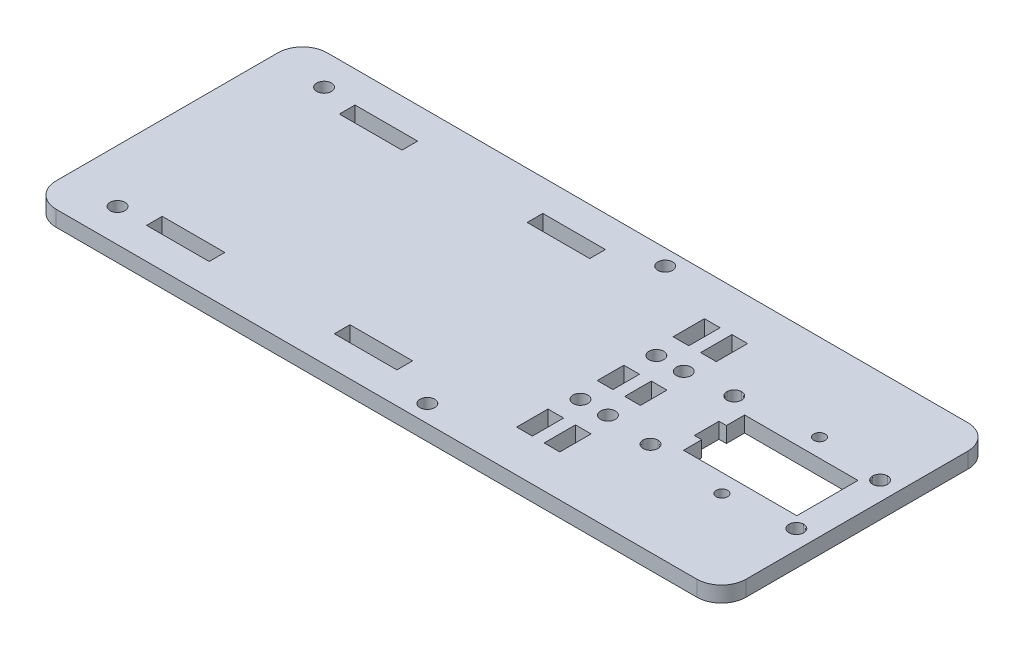
from build123d import *

# Parameters (mm, degrees)
SKETCH1_R           = 1.5
SKETCH1_R_2         = 1.15
SKETCH1_W           = 3.175
SKETCH1_H           = 6.35
SKETCH1_H_2         = 5.4
SKETCH1_W_2         = 12.7
SKETCH1_H_3         = 3.175
BOSS_EXTRUDE1_DEPTH = 3.175


with BuildPart() as part:
    # Sketch1 → Boss-Extrude1 (new body)
    with BuildSketch(Plane(origin=(0, 0, 0), x_dir=(1, 0, 0), z_dir=(0, 1, 0))):
        with BuildLine():
            Line((5, 0), (135, 0))
            ThreePointArc((135, 0), (138.535533906, 1.464466094), (140, 5))
            Line((140, 5), (140, 50))
            ThreePointArc((140, 50), (138.535533906, 53.535533906), (135, 55))
            Line((135, 55), (5, 55))
            ThreePointArc((5, 55), (1.464466094, 53.535533906), (0, 50))
            Line((0, 50), (0, 5))
            ThreePointArc((0, 5), (1.464466094, 1.464466094), (5, 0))
        make_face()
        with Locations((91.5875, 35.2)):
            Circle(SKETCH1_R, mode=Mode.SUBTRACT)
        with Locations((97.1625, 35.2)):
            Circle(SKETCH1_R, mode=Mode.SUBTRACT)
        with Locations((91.5875, 19.8)):
            Circle(SKETCH1_R, mode=Mode.SUBTRACT)
        with Locations((97.1625, 19.8)):
            Circle(SKETCH1_R, mode=Mode.SUBTRACT)
        with Locations((10.73981072, 48.62727462)):
            Circle(SKETCH1_R, mode=Mode.SUBTRACT)
        with Locations((10.73981072, 6.71727462)):
            Circle(SKETCH1_R, mode=Mode.SUBTRACT)
        with Locations((76.77981072, 3.54227462)):
            Circle(SKETCH1_R, mode=Mode.SUBTRACT)
        with Locations((76.77981072, 51.80227462)):
            Circle(SKETCH1_R, mode=Mode.SUBTRACT)
        with Locations((122.5, 37.4)):
            Circle(SKETCH1_R_2, mode=Mode.SUBTRACT)
        with Locations((122.5, 17.6)):
            Circle(SKETCH1_R_2, mode=Mode.SUBTRACT)
        with Locations((91.5875, 43.375)):
            Rectangle(SKETCH1_W, SKETCH1_H, mode=Mode.SUBTRACT)
        with Locations((91.5875, 11.625)):
            Rectangle(SKETCH1_W, SKETCH1_H, mode=Mode.SUBTRACT)
        with Locations((91.5875, 27.5)):
            Rectangle(SKETCH1_W, SKETCH1_H_2, mode=Mode.SUBTRACT)
        with Locations((97.1625, 43.375)):
            Rectangle(SKETCH1_W, SKETCH1_H, mode=Mode.SUBTRACT)
        with Locations((97.1625, 27.5)):
            Rectangle(SKETCH1_W, SKETCH1_H_2, mode=Mode.SUBTRACT)
        with Locations((97.1625, 11.625)):
            Rectangle(SKETCH1_W, SKETCH1_H, mode=Mode.SUBTRACT)
        with Locations((61.45, 7.9375)):
            Rectangle(SKETCH1_W_2, SKETCH1_H_3, mode=Mode.SUBTRACT)
        with Locations((23.35, 47.0625)):
            Rectangle(SKETCH1_W_2, SKETCH1_H_3, mode=Mode.SUBTRACT)
        with Locations((61.45, 47.0625)):
            Rectangle(SKETCH1_W_2, SKETCH1_H_3, mode=Mode.SUBTRACT)
        with Locations((23.35, 7.9375)):
            Rectangle(SKETCH1_W_2, SKETCH1_H_3, mode=Mode.SUBTRACT)
        Polygon((116.5, 33.7), (128.5, 33.7), (134, 33.7), (134, 21.3), (131.3, 21.3), (116.5, 21.3), (111, 21.3), (111, 25), (109.5001, 25), (109.5001, 30), (111, 30), (111, 33.7), align=None, mode=Mode.SUBTRACT)
        with BuildLine():
            add(Edge.make_bspline(
                [(108.1, 36), (108.1, 35.1715), (107.4285, 34.5), (106.6001, 34.5)],
                knots=[0, 0, 0, 0, 0.2, 0.2, 0.2, 0.2], degree=3))
            add(Edge.make_bspline(
                [(106.6001, 34.5), (105.7716, 34.4999), (105.1001, 35.1715), (105.1001, 35.9999)],
                knots=[0.2, 0.2, 0.2, 0.2, 0.4, 0.4, 0.4, 0.4], degree=3))
            add(Edge.make_bspline(
                [(105.1001, 35.9999), (105.1, 36.8284), (105.7716, 37.4999), (106.6, 37.5)],
                knots=[0.4, 0.4, 0.4, 0.4, 0.6, 0.6, 0.6, 0.6], degree=3))
            add(Edge.make_bspline(
                [(106.6, 37.5), (107.4285, 37.5), (108.1, 36.8284), (108.1, 36)],
                knots=[0.6, 0.6, 0.6, 0.6, 1, 1, 1, 1], degree=3))
        make_face(mode=Mode.SUBTRACT)
        with BuildLine():
            add(Edge.make_bspline(
                [(137.7, 19.0002), (137.7, 18.1718), (137.0284, 17.5002), (136.2001, 17.5002)],
                knots=[0, 0, 0, 0, 0.2, 0.2, 0.2, 0.2], degree=3))
            add(Edge.make_bspline(
                [(136.2001, 17.5002), (135.3717, 17.5002), (134.7001, 18.1718), (134.7001, 19.0001)],
                knots=[0.2, 0.2, 0.2, 0.2, 0.4, 0.4, 0.4, 0.4], degree=3))
            add(Edge.make_bspline(
                [(134.7001, 19.0001), (134.7001, 19.8285), (135.3717, 20.4999), (136.2, 20.4999)],
                knots=[0.4, 0.4, 0.4, 0.4, 0.6, 0.6, 0.6, 0.6], degree=3))
            add(Edge.make_bspline(
                [(136.2, 20.4999), (137.0284, 20.4999), (137.7, 19.8285), (137.7, 19.0002)],
                knots=[0.6, 0.6, 0.6, 0.6, 1, 1, 1, 1], degree=3))
        make_face(mode=Mode.SUBTRACT)
        with BuildLine():
            add(Edge.make_bspline(
                [(108.1, 19.0002), (108.1, 18.1718), (107.4284, 17.5001), (106.6001, 17.5001)],
                knots=[0, 0, 0, 0, 0.2, 0.2, 0.2, 0.2], degree=3))
            add(Edge.make_bspline(
                [(106.6001, 17.5001), (105.7717, 17.5001), (105.1, 18.1718), (105.1, 19.0001)],
                knots=[0.2, 0.2, 0.2, 0.2, 0.4, 0.4, 0.4, 0.4], degree=3))
            add(Edge.make_bspline(
                [(105.1, 19.0001), (105.1, 19.8285), (105.7717, 20.5), (106.6, 20.5)],
                knots=[0.4, 0.4, 0.4, 0.4, 0.6, 0.6, 0.6, 0.6], degree=3))
            add(Edge.make_bspline(
                [(106.6, 20.5), (107.4284, 20.5), (108.1, 19.8285), (108.1, 19.0002)],
                knots=[0.6, 0.6, 0.6, 0.6, 1, 1, 1, 1], degree=3))
        make_face(mode=Mode.SUBTRACT)
        with BuildLine():
            add(Edge.make_bspline(
                [(137.7, 36), (137.7, 35.1715), (137.0285, 34.5001), (136.2001, 34.5001)],
                knots=[0, 0, 0, 0, 0.2, 0.2, 0.2, 0.2], degree=3))
            add(Edge.make_bspline(
                [(136.2001, 34.5001), (135.3716, 34.5), (134.7002, 35.1715), (134.7002, 35.9999)],
                knots=[0.2, 0.2, 0.2, 0.2, 0.4, 0.4, 0.4, 0.4], degree=3))
            add(Edge.make_bspline(
                [(134.7002, 35.9999), (134.7001, 36.8284), (135.3716, 37.4998), (136.2, 37.4999)],
                knots=[0.4, 0.4, 0.4, 0.4, 0.6, 0.6, 0.6, 0.6], degree=3))
            add(Edge.make_bspline(
                [(136.2, 37.4999), (137.0285, 37.4999), (137.7, 36.8284), (137.7, 36)],
                knots=[0.6, 0.6, 0.6, 0.6, 1, 1, 1, 1], degree=3))
        make_face(mode=Mode.SUBTRACT)
    extrude(amount=BOSS_EXTRUDE1_DEPTH)


solid = part.part
